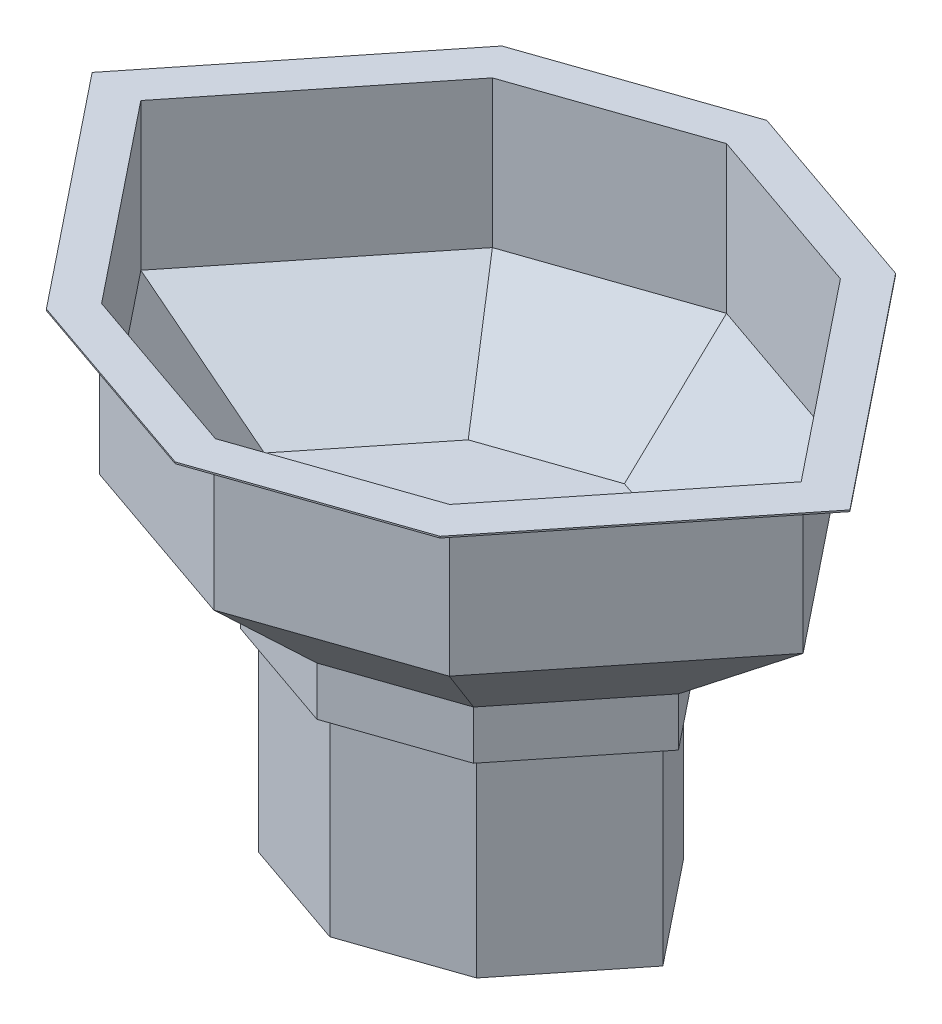
from build123d import *

# Parameters (mm, degrees)
BOSS_EXTRUDE1_DEPTH = 406.4
BOSS_EXTRUDE2_DEPTH = 101.6
BOSS_EXTRUDE3_DEPTH = 304.8
BOSS_EXTRUDE4_DEPTH = 3.175
SHELL3_START        = 712.515128061
SHELL3_DEPTH        = 306.659871939


with BuildPart() as part:
    # Sketch2 → Boss-Extrude1 (new body)
    with BuildSketch(Plane(origin=(0, 0, 0), x_dir=(1, 0, 0), z_dir=(0, 1, 0))):
        Polygon((-227.727393818, 215.912914456), (-400.269809967, 0), (-227.727393818, -215.912914456), (0, -294.634699703), (227.727393818, -215.912914456), (400.269809967, 0), (227.727393818, 215.912914456), (0, 294.634699703), align=None)
    extrude(amount=BOSS_EXTRUDE1_DEPTH)


with BuildPart() as body_2:
    # Sketch3 → Boss-Extrude2 (new body)
    with BuildSketch(Plane(origin=(0, 406.4, 0), x_dir=(1, 0, 0), z_dir=(0, 1, 0))):
        Polygon((0, 321.509503803), (-242.977909201, 237.515854786), (-432.783875933, 0), (-242.977909201, -237.515854786), (0, -321.509503803), (242.977909201, -237.515854786), (432.783875933, 0), (242.977909201, 237.515854786), align=None)
        Polygon((0, 294.634699703), (-227.727393818, 215.912914456), (-400.269809967, 0), (-227.727393818, -215.912914456), (0, -294.634699703), (227.727393818, -215.912914456), (400.269809967, 0), (227.727393818, 215.912914456), align=None, mode=Mode.SUBTRACT)
    extrude(amount=BOSS_EXTRUDE2_DEPTH)


with BuildPart() as body_3:
    # Sketch5 → Loft1 section 0
    with BuildSketch(Plane(origin=(0, 711.2, 0), x_dir=(1, 0, 0), z_dir=(0, 1, 0))):
        with BuildLine():
            Line((0, 536.5079366), (-364.98203226, 410.339377425))
            Line((-364.98203226, 410.339377425), (-692.896403665, 0))
            Line((-692.896403665, 0), (-364.98203226, -410.339377425))
            Line((-364.98203226, -410.339377425), (0, -536.5079366))
            Line((0, -536.5079366), (364.98203226, -410.339377425))
            Line((364.98203226, -410.339377425), (692.896403665, 0))
            Line((692.896403665, 0), (364.98203226, 410.339377425))
            Line((364.98203226, 410.339377425), (0, 536.5079366))
        make_face()
    # Sketch4 → Loft1 section 1
    with BuildSketch(Plane(origin=(0, 508, 0), x_dir=(1, 0, 0), z_dir=(0, 1, 0))):
        with BuildLine():
            Line((-242.977909201, 237.515854786), (-432.783875933, 0))
            Line((-432.783875933, 0), (-242.977909201, -237.515854786))
            Line((-242.977909201, -237.515854786), (0, -321.509503803))
            Line((0, -321.509503803), (242.977909201, -237.515854786))
            Line((242.977909201, -237.515854786), (432.783875933, 0))
            Line((432.783875933, 0), (242.977909201, 237.515854786))
            Line((242.977909201, 237.515854786), (0, 321.509503803))
            Line((0, 321.509503803), (-242.977909201, 237.515854786))
        make_face()
    loft()

    # Sketch6 → Boss-Extrude3 (add)
    with BuildSketch(Plane(origin=(0, 711.2, 0), x_dir=(1, 0, 0), z_dir=(0, 1, 0))):
        Polygon((-364.98203226, -410.339377425), (0, -536.5079366), (364.98203226, -410.339377425), (692.896403665, 0), (364.98203226, 410.339377425), (0, 536.5079366), (-364.98203226, 410.339377425), (-692.896403665, 0), align=None)
    extrude(amount=BOSS_EXTRUDE3_DEPTH)

    # Sketch7 → Boss-Extrude4 (add)
    with BuildSketch(Plane(origin=(0, 1016, 0), x_dir=(1, 0, 0), z_dir=(0, 1, 0))):
        Polygon((-790.438601564, 0), (-410.733578407, -475.148198415), (0, -617.132348899), (410.733578407, -475.148198415), (790.438601564, 0), (410.733578407, 475.148198415), (0, 617.132348899), (-410.733578407, 475.148198415), align=None)
    extrude(amount=BOSS_EXTRUDE4_DEPTH)

    # Shell3: read off the stored shape, not the designer's step
    # Shell3 outline → Shell3 (cut)
    with BuildSketch(Plane(origin=(0, 0, 0), x_dir=(1, 0, 0), z_dir=(0, 1, 0)).offset(SHELL3_START)):
        Polygon((-688.832145419, 0), (-363.075717837, -407.639009884), (0, -533.148586088), (363.075717837, -407.639009884), (688.832145419, 0), (363.075717837, 407.639009884), (0, 533.148586088), (-363.075717837, 407.639009884), align=None)
    extrude(amount=SHELL3_DEPTH, mode=Mode.SUBTRACT)

    # Shell3 2: loft between two sections, ruled curve by curve
    shell3_2_from = [
        Edge.make_line((-242.188287913, 511.175, -236.397325927), (-431.100405047, 511.175, 0)),
        Edge.make_line((-431.100405047, 511.175, 0), (-242.188287913, 511.175, 236.397325927)),
        Edge.make_line((0, 511.175, -320.11801526), (-242.188287913, 511.175, -236.397325927)),
        Edge.make_line((242.188287913, 511.175, -236.397325927), (0, 511.175, -320.11801526)),
        Edge.make_line((431.100405047, 511.175, 0), (242.188287913, 511.175, -236.397325927)),
        Edge.make_line((242.188287913, 511.175, 236.397325927), (431.100405047, 511.175, 0)),
        Edge.make_line((0, 511.175, 320.11801526), (242.188287913, 511.175, 236.397325927)),
        Edge.make_line((-242.188287913, 511.175, 236.397325927), (0, 511.175, 320.11801526)),
    ]
    shell3_2_to = [
        Edge.make_line((-363.075717837, 712.515128061, -407.639009884), (-688.832145419, 712.515128061, 0)),
        Edge.make_line((-688.832145419, 712.515128061, 0), (-363.075717837, 712.515128061, 407.639009884)),
        Edge.make_line((0, 712.515128061, -533.148586088), (-363.075717837, 712.515128061, -407.639009884)),
        Edge.make_line((363.075717837, 712.515128061, -407.639009884), (0, 712.515128061, -533.148586088)),
        Edge.make_line((688.832145419, 712.515128061, 0), (363.075717837, 712.515128061, -407.639009884)),
        Edge.make_line((363.075717837, 712.515128061, 407.639009884), (688.832145419, 712.515128061, 0)),
        Edge.make_line((0, 712.515128061, 533.148586088), (363.075717837, 712.515128061, 407.639009884)),
        Edge.make_line((-363.075717837, 712.515128061, 407.639009884), (0, 712.515128061, 533.148586088)),
    ]
    shell3_2 = Solid(Shell([*[Face.make_surface_from_curves(shell3_2_from[k], shell3_2_to[k]) for k in range(8)], Face(Wire(shell3_2_from)), Face(Wire(shell3_2_to))]))
    add(shell3_2, mode=Mode.SUBTRACT)


solid = Compound([part.part, body_2.part, body_3.part])
